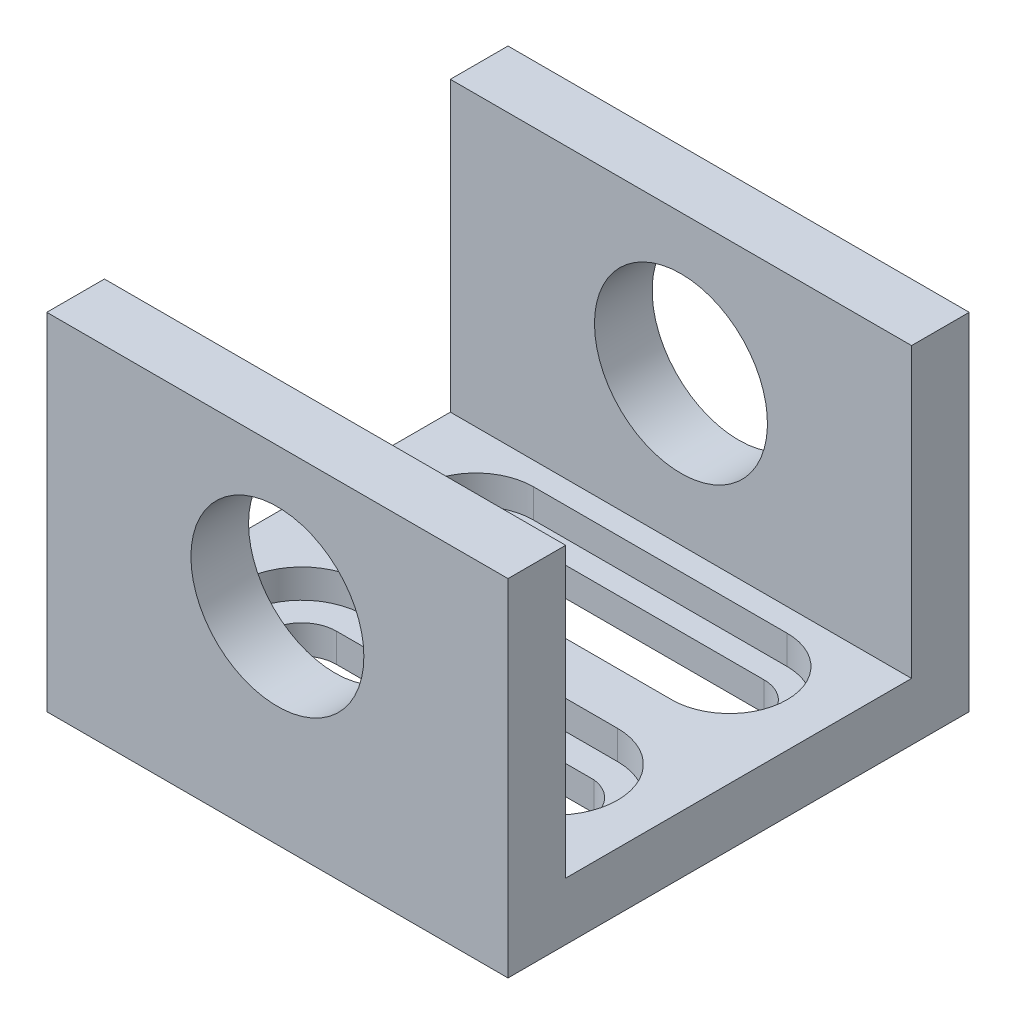
from build123d import *

# Parameters (mm, degrees)
BOSS_EXTRUDE2_DEPTH = 25.4
SKETCH3_R           = 4.7625
CUT_EXTRUDE1_DEPTH  = 36.576
CUT_EXTRUDE2_DEPTH  = 66.04
CUT_EXTRUDE3_DEPTH  = 1.5875
CUT_EXTRUDE4_DEPTH  = 1.5875
CUT_EXTRUDE5_DEPTH  = 38.297804895


with BuildPart() as part:
    # Sketch1 → Boss-Extrude2 (new body)
    with BuildSketch(Plane(origin=(0, 0, 0), x_dir=(0, 0, -1), z_dir=(1, 0, 0))):
        Polygon((0, 0), (-19.05, 0), (-22.225, 0), (-22.225, 19.05), (-19.05, 19.05), (-19.05, 3.175), (0, 3.175), (0, 19.05), (3.175, 19.05), (3.175, 0), align=None)
    extrude(amount=BOSS_EXTRUDE2_DEPTH)

    # Sketch3 → Cut-Extrude1 (cut)
    with BuildSketch(Plane(origin=(0, 0, -3.175), x_dir=(-1, 0, 0), z_dir=(0, 0, -1))):
        with Locations((-12.7, 11.3665)):
            Circle(SKETCH3_R)
    extrude(amount=-CUT_EXTRUDE1_DEPTH, mode=Mode.SUBTRACT)

    # Sketch4 → Cut-Extrude2 (cut)
    with BuildSketch(Plane(origin=(0, 3.175, 0), x_dir=(1, 0, 0), z_dir=(0, 1, 0))):
        with BuildLine():
            Line((5.845487438, -2.54), (19.815487438, -2.54))
            ThreePointArc((19.815487438, -2.54), (21.720487438, -4.445), (19.815487438, -6.35))
            Line((19.815487438, -6.35), (5.845487438, -6.35))
            ThreePointArc((5.845487438, -6.35), (3.940487438, -4.445), (5.845487438, -2.54))
        make_face()
    extrude(amount=-CUT_EXTRUDE2_DEPTH, mode=Mode.SUBTRACT)

    # Sketch7 → Cut-Extrude3 (cut)
    with BuildSketch(Plane(origin=(0, 3.175, 0), x_dir=(1, 0, 0), z_dir=(0, 1, 0))):
        with BuildLine():
            Line((5.845487438, -1.27), (19.815487438, -1.27))
            ThreePointArc((19.815487438, -1.27), (22.990487438, -4.445), (19.815487438, -7.62))
            Line((19.815487438, -7.62), (5.845487438, -7.62))
            ThreePointArc((5.845487438, -7.62), (2.670487438, -4.445), (5.845487438, -1.27))
        make_face()
    extrude(amount=-CUT_EXTRUDE3_DEPTH, mode=Mode.SUBTRACT)

    # Sketch8 → Cut-Extrude4 (cut)
    with BuildSketch(Plane(origin=(0, 3.175, 0), x_dir=(1, 0, 0), z_dir=(0, 1, 0))):
        with BuildLine():
            Line((19.685, -10.475216671), (5.906934367, -10.475216671))
            ThreePointArc((5.906934367, -10.475216671), (2.28734423, -13.802835984), (5.715, -17.327840803))
            Line((5.715, -17.327840803), (19.685, -17.327840803))
            ThreePointArc((19.685, -17.327840803), (23.111312066, -13.901528737), (19.685, -10.475216671))
        make_face()
    extrude(amount=-CUT_EXTRUDE4_DEPTH, mode=Mode.SUBTRACT)

    # Sketch8<3> → Cut-Extrude5 (cut, through all)
    with BuildSketch(Plane(origin=(0, 3.175, 0), x_dir=(1, 0, 0), z_dir=(0, 1, 0))):
        with BuildLine():
            Line((19.90096042, -11.993840803), (5.715, -11.993840803))
            ThreePointArc((5.715, -11.993840803), (3.81, -13.898840803), (5.715, -15.803840803))
            Line((5.715, -15.803840803), (19.425922871, -15.803840803))
            ThreePointArc((19.425922871, -15.803840803), (21.590121981, -14.13906272), (19.90096042, -11.993840803))
        make_face()
    extrude(amount=-CUT_EXTRUDE5_DEPTH, mode=Mode.SUBTRACT)


solid = part.part
